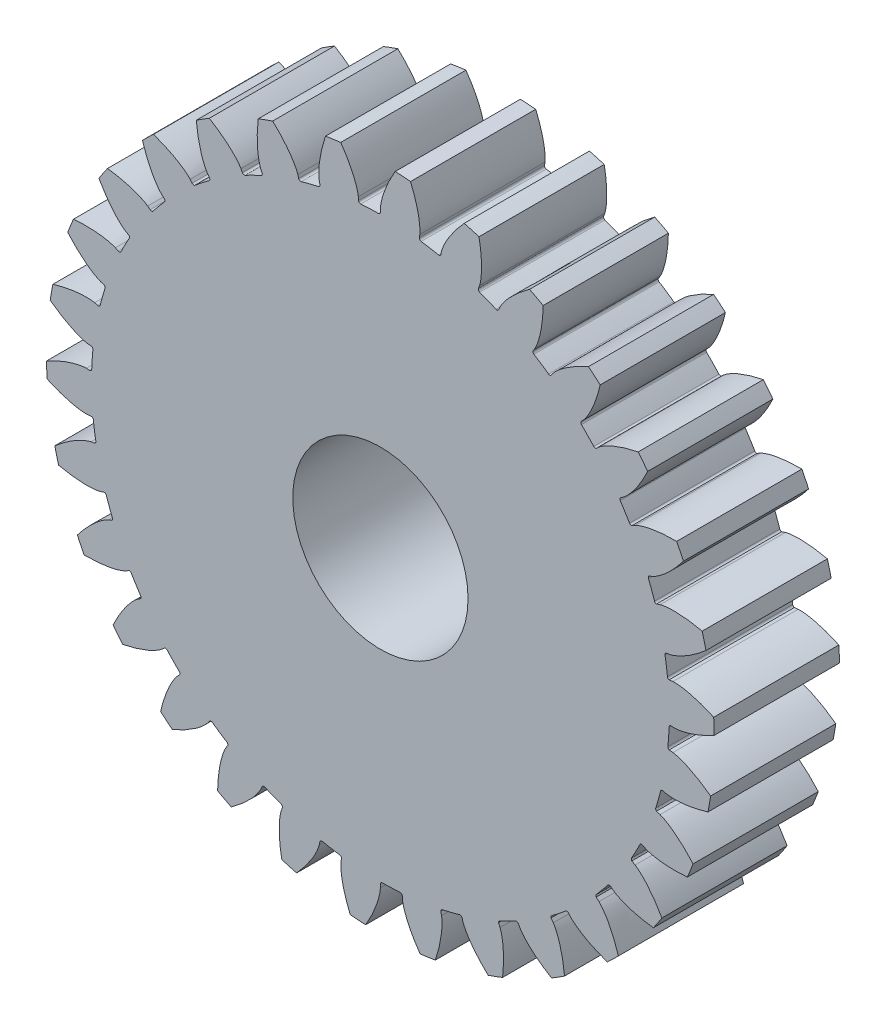
from build123d import *

# Parameters (mm, degrees)
CROQUIS2_R              = 5.25
SALIENTE_EXTRUIR1_DEPTH = 7.5
MATRIZC6_COUNT          = 30


with BuildPart() as part:
    # Croquis2 → Saliente-Extruir1 (new body)
    with BuildSketch(Plane.XY):
        with BuildLine():
            Line((0, 17.391052591), (0, 17.61923664))
            add(Edge.make_bspline(
                [(0, 17.61923664), (0.002968389, 17.708678911), (0.030865619, 17.908423079), (0.110728878, 18.25740541), (0.25502818, 18.704841344), (0.488882061, 19.262091692), (0.716792081, 19.695707807), (0.862564894, 19.944247124), (0.88412324, 19.980448596)],
                knots=[0, 0, 0, 0, 0.049384323, 0.111112812, 0.197532517, 0.308643471, 0.44444569, 0.467706461, 0.467706461, 0.467706461, 0.467706461], degree=3))
            ThreePointArc((0.88412324, 19.980448596), (1.344285858, 19.954771247), (1.80373463, 19.918497468))
            add(Edge.make_bspline(
                [(2.363172784, 17.460037633), (2.372227624, 17.549069881), (2.371373063, 17.75075096), (2.33903852, 18.10729168), (2.256055196, 18.57003888), (2.099055278, 19.153619735), (1.931363125, 19.613886239), (1.820242679, 19.879731591), (1.80373463, 19.918497468)],
                knots=[0, 0, 0, 0, 0.049384323, 0.111112812, 0.197532517, 0.308643471, 0.44444569, 0.467706461, 0.467706461, 0.467706461, 0.467706461], degree=3))
            Line((2.363172784, 17.460037633), (2.332489759, 17.275351458))
            ThreePointArc((2.332489759, 17.275351458), (2.354972763, 17.180980546), (2.438186458, 17.131112365))
            ThreePointArc((2.438186458, 17.131112365), (-1.163059321, -17.264618649), (-0.118452851, 17.303344561))
            ThreePointArc((-0.118452851, 17.303344561), (-0.044924166, 17.327882859), (0, 17.391052591))
        make_face()
        Circle(CROQUIS2_R, mode=Mode.SUBTRACT)
    saliente_extruir1 = extrude(amount=SALIENTE_EXTRUIR1_DEPTH)

    # MatrizC6: Saliente-Extruir1 ×30 about axis
    matrizc6_axis = Axis((0, 0, 7.5), (0, 0, -1))
    for i in range(1, MATRIZC6_COUNT):
        add(saliente_extruir1.rotate(matrizc6_axis, i * 360 / MATRIZC6_COUNT))


solid = part.part
